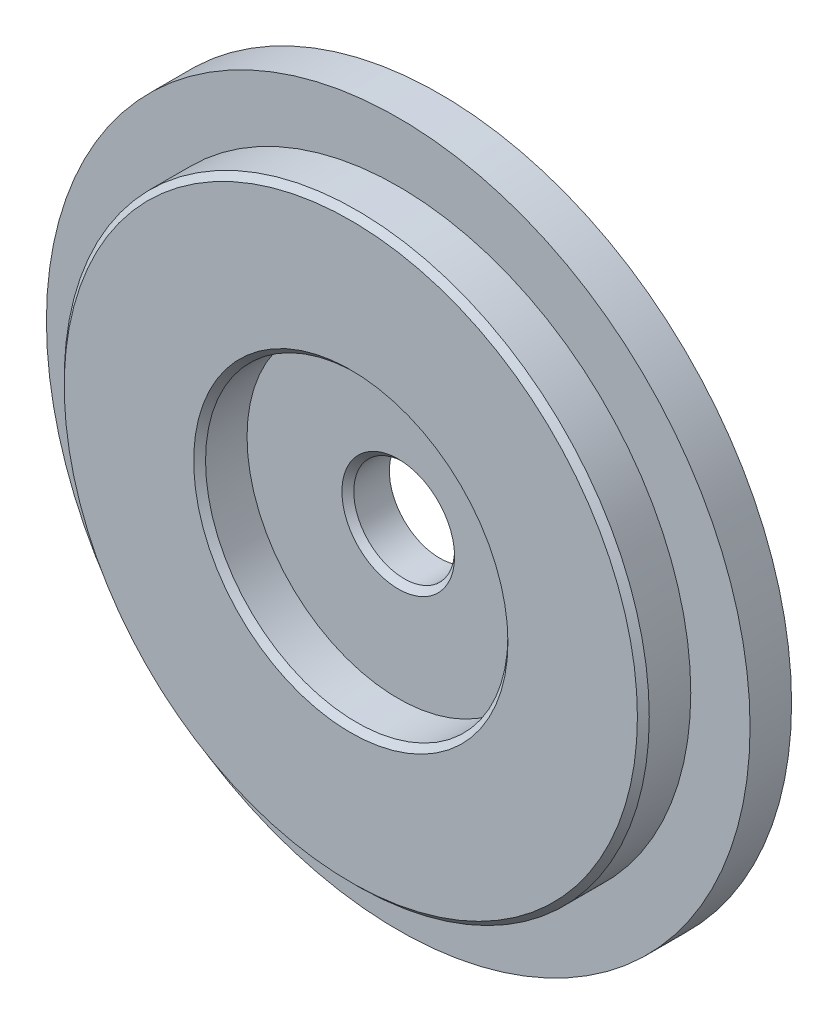
from build123d import *

# Parameters (mm, degrees)
SKETCH_1_R          = 17.8
EXTRUDE_1_DEPTH     = 2.1
SKETCH_2_R          = 14.8
SKETCH_2_R_2        = 7.65
EXTRUDE_2_DEPTH     = 4.5
CUT_EXTRUDE_1_REACH = 27.572
SKETCH_3_R          = 2.55
CHAMFER_1_SIZE      = 0.3


with BuildPart() as part:
    # 草图1 → 凸台-拉伸1 (new body)
    with BuildSketch(Plane.XY):
        Circle(SKETCH_1_R)
    extrude(amount=EXTRUDE_1_DEPTH)

    # 草图2 → 凸台-拉伸2 (add)
    with BuildSketch(Plane.XY):
        Circle(SKETCH_2_R)
        Circle(SKETCH_2_R_2, mode=Mode.SUBTRACT)
    extrude(amount=EXTRUDE_2_DEPTH)

    # 草图3 → 切除-拉伸1 (cut, up to next)
    with BuildSketch(Plane.XY, mode=Mode.PRIVATE) as cut_extrude_1_sk1:
        Circle(SKETCH_3_R)
    cut_extrude_1_tool1 = extrude(cut_extrude_1_sk1.sketch, amount=CUT_EXTRUDE_1_REACH, mode=Mode.PRIVATE) & part.part
    add(cut_extrude_1_tool1.solids().sort_by_distance((0, 0, 0))[0], mode=Mode.SUBTRACT)

    # 倒角1
    chamfer_1_edges = [part.edges().sort_by_distance(p)[0] for p in [
        (-7.65, 0, 4.5),
        (-2.55, 0, 2.1),
        (-14.8, 0, 4.5),
    ]]
    chamfer(chamfer_1_edges, length=CHAMFER_1_SIZE)


solid = part.part
